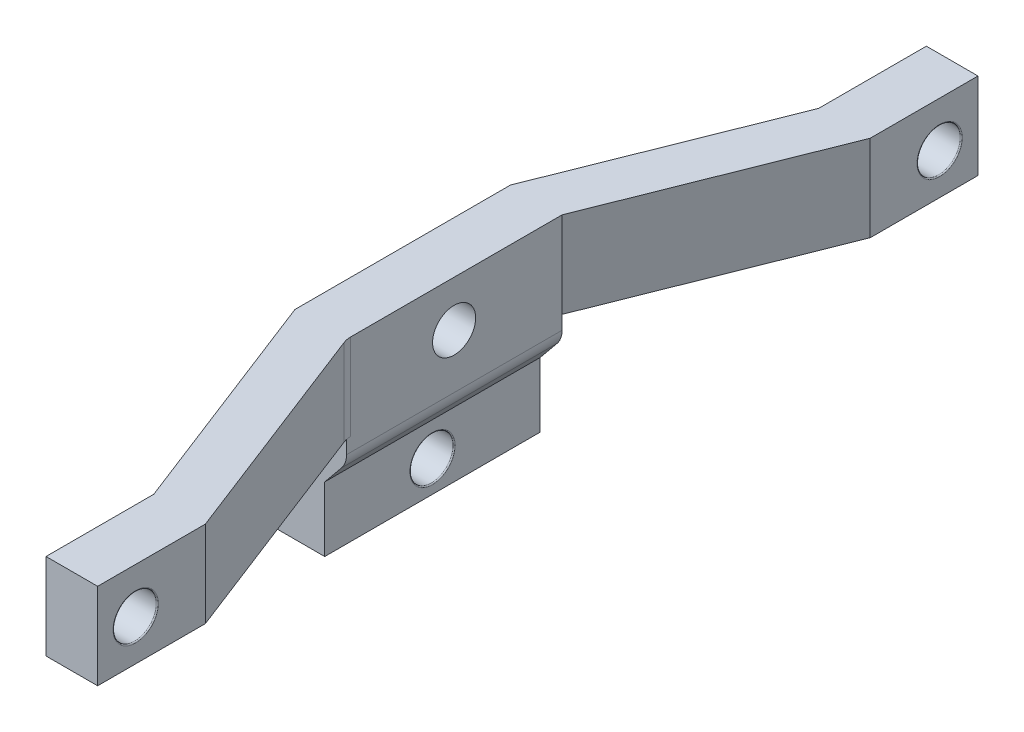
from build123d import *

# Parameters (mm, degrees)
BOSS_EXTRUDE1_DEPTH = 50
BOSS_EXTRUDE2_DEPTH = 20
FILLET1_R           = 5.08
FILLET2_R           = 5.08
SKETCH3_R           = 5
CUT_EXTRUDE3_DEPTH  = 50.8
SKETCH4_R           = 5
CUT_EXTRUDE4_DEPTH  = 137.256289695
SKETCH22_R          = 5
CUT_EXTRUDE12_DEPTH = 15
FILLET4_R           = 0.254
FILLET5_R           = 0.254
FILLET6_R           = 0.254
FILLET7_R           = 0.254
FILLET8_R           = 0.254
FILLET9_R           = 0.254


with BuildPart() as part:
    # Sketch1 → Boss-Extrude1 (new body)
    with BuildSketch(Plane.XY):
        Polygon((-11.977890458, 5), (0, 5), (0, 0), (-5.06956252, -6.188661879), (-5.06956252, -21.188661879), (-17.047452978, -21.188661879), (-17.047452978, -6.188661879), (-11.977890458, 0), align=None)
    extrude(amount=BOSS_EXTRUDE1_DEPTH)

    # Sketch2 → Boss-Extrude2 (add)
    with BuildSketch(Plane(origin=(0, 5, 0), x_dir=(1, 0, 0), z_dir=(0, 1, 0))):
        Polygon((-11.977890458, -50), (8.771796304, -103.499621435), (8.771796304, -128.499621435), (20.749686761, -128.499621435), (20.749686761, -103.499621435), (0, -50), (0, 0), (20.342991197, 51.139135916), (20.342991197, 76.139135916), (8.365100739, 76.139135916), (8.365100739, 51.139135916), (-11.977890458, 0), align=None)
    extrude(amount=BOSS_EXTRUDE2_DEPTH)

    # Fillet1
    fillet1_edges = [part.edges().sort_by_distance(p)[0] for p in [
        (0, 0, 25),
    ]]
    fillet(fillet1_edges, radius=FILLET1_R)

    # Fillet2
    fillet2_edges = [part.edges().sort_by_distance(p)[0] for p in [
        (0, 15, 50),
    ]]
    fillet(fillet2_edges, radius=FILLET2_R)

    # Sketch3 → Cut-Extrude3 (cut)
    with BuildSketch(Plane.ZY.offset(11.977890458)):
        with Locations((-67.254749334, 14.458805711)):
            Circle(SKETCH3_R)
        with Locations((119.665250666, 14.458805711)):
            Circle(SKETCH3_R)
    extrude(amount=-CUT_EXTRUDE3_DEPTH, mode=Mode.SUBTRACT)

    # Sketch4 → Cut-Extrude4 (cut, through all)
    with BuildSketch(Plane.ZY.offset(17.047452978)):
        with Locations((25, -14)):
            Circle(SKETCH4_R)
    extrude(amount=-CUT_EXTRUDE4_DEPTH, mode=Mode.SUBTRACT)

    # Sketch22 → Cut-Extrude12 (cut)
    with BuildSketch(Plane.ZY.offset(11.977890458)):
        with Locations((25.051521291, 14.349304993)):
            Circle(SKETCH22_R)
    extrude(amount=-CUT_EXTRUDE12_DEPTH, mode=Mode.SUBTRACT)

    # Fillet4
    fillet4_edges = [part.edges().sort_by_distance(p)[0] for p in [
        (-5.06956252, -14, 20),
    ]]
    fillet(fillet4_edges, radius=FILLET4_R)

    # Fillet5
    fillet5_edges = [part.edges().sort_by_distance(p)[0] for p in [
        (-17.047452978, -14, 20),
    ]]
    fillet(fillet5_edges, radius=FILLET5_R)

    # Fillet6
    fillet6_edges = [part.edges().sort_by_distance(p)[0] for p in [
        (20.342991197, 14.458805711, -72.254749334),
    ]]
    fillet(fillet6_edges, radius=FILLET6_R)

    # Fillet7
    fillet7_edges = [part.edges().sort_by_distance(p)[0] for p in [
        (8.365100739, 14.458805711, -72.254749334),
    ]]
    fillet(fillet7_edges, radius=FILLET7_R)

    # Fillet8
    fillet8_edges = [part.edges().sort_by_distance(p)[0] for p in [
        (20.749686761, 14.458805711, 114.665250666),
    ]]
    fillet(fillet8_edges, radius=FILLET8_R)

    # Fillet9
    fillet9_edges = [part.edges().sort_by_distance(p)[0] for p in [
        (8.771796304, 14.458805711, 114.665250666),
    ]]
    fillet(fillet9_edges, radius=FILLET9_R)


solid = part.part
